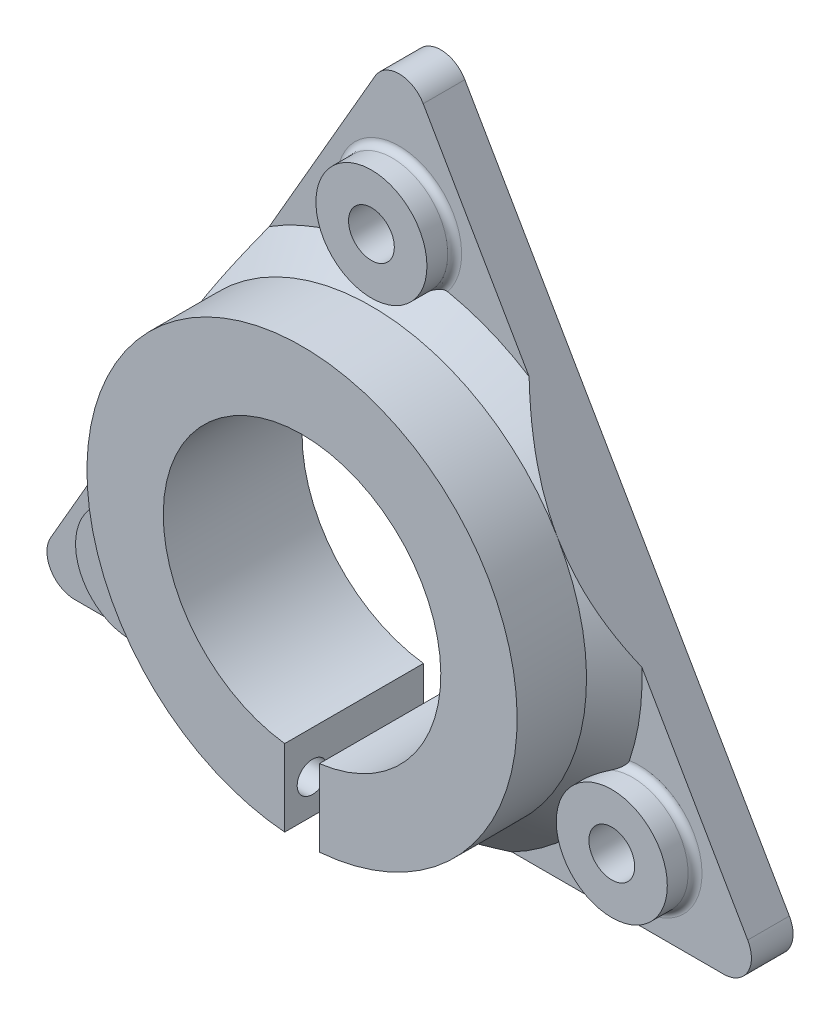
from build123d import *

# Parameters (mm, degrees)
SKETCH_1_R               = 1.65
SKETCH_1_R_2             = 9
EXTRUDE_1_DEPTH          = 3
SKETCH_2_R               = 15.5
SKETCH_2_R_2             = 9
EXTRUDE_2_DEPTH          = 7
SKETCH_3_W               = 2.5
SKETCH_3_H               = 20
CUT_EXTRUDE_1_DEPTH      = 28
CUT_EXTRUDE_2_DEPTH      = 44.016618519
CUT_EXTRUDE_2_DEPTH_BACK = 44.016618519
SKETCH_4_R               = 1.1
SKETCH_5_R               = 10
CUT_EXTRUDE_3_DEPTH      = 43.210780613
SKETCH_6_R               = 1.9
CUT_EXTRUDE_8_DEPTH      = 13
CHAMFER_1_SIZE           = 2
FILLET_2_R               = 2
SKETCH_7_R               = 4
SKETCH_7_R_2             = 1.65
EXTRUDE_3_DEPTH          = 2
FILLET_3_R               = 0.5


with BuildPart() as part:
    # 草图1 → 凸台-拉伸1 (new body)
    with BuildSketch(Plane.XY):
        Polygon((0, 31), (-26.846787517, -15.5), (26.846787517, -15.5), align=None)
        with Locations((0, 20)):
            Circle(SKETCH_1_R, mode=Mode.SUBTRACT)
        with Locations((17.320508076, -10)):
            Circle(SKETCH_1_R, mode=Mode.SUBTRACT)
        with Locations((-17.320508076, -10)):
            Circle(SKETCH_1_R, mode=Mode.SUBTRACT)
        Circle(SKETCH_1_R_2, mode=Mode.SUBTRACT)
    extrude(amount=EXTRUDE_1_DEPTH)

    # 草图2 → 凸台-拉伸2 (add)
    with BuildSketch(Plane.XY.offset(3)):
        with Locations(Location((0, 0, 0), (0, 0, 150))):
            Circle(SKETCH_2_R)
        Circle(SKETCH_2_R_2, mode=Mode.SUBTRACT)
    extrude(amount=EXTRUDE_2_DEPTH)

    # 草图3 → 切除-拉伸1 (cut)
    with BuildSketch(Plane.XY.offset(10)):
        with Locations((0, -9)):
            Rectangle(SKETCH_3_W, SKETCH_3_H)
    extrude(amount=-CUT_EXTRUDE_1_DEPTH, mode=Mode.SUBTRACT)

    # 草图4 → 切除-拉伸2 (cut, two sides: drawn at the far end of the back side and taken through both)
    with BuildSketch(Plane(origin=(-1.25, 0, 0), x_dir=(0, 0, -1), z_dir=(1, 0, 0)).offset(-CUT_EXTRUDE_2_DEPTH_BACK)):
        with Locations(Location((-8, -13, 0), (0, 0, 90))):
            Circle(SKETCH_4_R)
    extrude(amount=CUT_EXTRUDE_2_DEPTH + CUT_EXTRUDE_2_DEPTH_BACK, mode=Mode.SUBTRACT)

    # 草图5 → 切除-拉伸3 (cut, through all)
    with BuildSketch(Plane.XY.offset(10)):
        Circle(SKETCH_5_R)
    extrude(amount=-CUT_EXTRUDE_3_DEPTH, mode=Mode.SUBTRACT)

    # 草图6 → 切除-拉伸8 (cut)
    with BuildSketch(Plane(origin=(18.75, 0, 0), x_dir=(0, 0, -1), z_dir=(1, 0, 0))):
        with Locations((-8, -13)):
            Circle(SKETCH_6_R)
    cut_extrude_8 = extrude(amount=-CUT_EXTRUDE_8_DEPTH, mode=Mode.SUBTRACT)

    # 镜向1: 切除-拉伸8 across plane
    add(cut_extrude_8.mirror(Plane(origin=(0, 0, 0), x_dir=(0, 0, 1), z_dir=(1, 0, 0))), mode=Mode.SUBTRACT)

    # 倒角1
    # the kernel refuses this chamfer: 2 mm, written as the material it adds along each edge
    with BuildSketch(Plane(origin=(0, 0, 3), x_dir=(-0.24867915141291427, -0.9685859175378057, 0), z_dir=(-0.9685859175378057, 0.24867915141291427, 0))) as chamfer_1_piece_1_section:
        Polygon((15.5 + CHAMFER_1_SIZE, 0), (15.5, CHAMFER_1_SIZE), (15.5, 0), align=None)
    chamfer_1_piece_1 = revolve(axis=Axis((0, 0, 3), (0, 0, 1)), revolution_arc=134.399365049, mode=Mode.PRIVATE)
    chamfer_1_piece_1 = split(chamfer_1_piece_1, bisect_by=Plane(origin=(-1.25, -15.346279834, 3.925823909), z_dir=(-1, 0, 0)), keep=Keep.TOP, mode=Mode.PRIVATE)
    chamfer_1_piece_1 = split(chamfer_1_piece_1, bisect_by=Plane(origin=(-2.983750464, -15.5, 3.925823909), z_dir=(0, 1, 0)), keep=Keep.TOP, mode=Mode.PRIVATE)
    add(chamfer_1_piece_1)
    with BuildSketch(Plane(origin=(0, 0, 3), x_dir=(-0.24867915141291427, -0.9685859175378057, 0), z_dir=(-0.9685859175378057, 0.24867915141291427, 0))) as chamfer_1_piece_2_section:
        Polygon((15.5 + CHAMFER_1_SIZE, 0), (15.5, CHAMFER_1_SIZE), (15.5, 0), align=None)
    chamfer_1_piece_2 = revolve(axis=Axis((0, 0, 3), (0, 0, 1)), revolution_arc=134.399365049, mode=Mode.PRIVATE)
    chamfer_1_piece_2 = split(chamfer_1_piece_2, bisect_by=Plane(origin=(1.25, -7.656401186, 3.97388988), z_dir=(1, 0, 0)), keep=Keep.TOP, mode=Mode.PRIVATE)
    chamfer_1_piece_2 = split(chamfer_1_piece_2, bisect_by=Plane(origin=(14.586588654, -15.5, 3.97388988), z_dir=(0, 1, 0)), keep=Keep.TOP, mode=Mode.PRIVATE)
    chamfer_1_piece_2 = split(chamfer_1_piece_2, bisect_by=Plane(origin=(20.385359887, -4.308479054, 3.97388988), z_dir=(-0.8660254037844387, -0.5000000000000001, 0)), keep=Keep.TOP, mode=Mode.PRIVATE)
    add(chamfer_1_piece_2)
    with BuildSketch(Plane(origin=(0, 0, 3), x_dir=(-0.8660254037844386, 0.4999999999999999, 0), z_dir=(0.4999999999999999, 0.8660254037844386, 0))) as chamfer_1_piece_3_section:
        Polygon((15.5 + CHAMFER_1_SIZE, 0), (15.5, CHAMFER_1_SIZE), (15.5, 0), align=None)
    chamfer_1_piece_3 = revolve(axis=Axis((0, 0, 3), (0, 0, 1)), revolution_arc=134.399364936, mode=Mode.PRIVATE)
    chamfer_1_piece_3 = split(chamfer_1_piece_3, bisect_by=Plane(origin=(-20.385359891, -4.308479063, 3.973889878), z_dir=(0.8660254037844387, -0.5000000000000001, 0)), keep=Keep.TOP, mode=Mode.PRIVATE)
    chamfer_1_piece_3 = split(chamfer_1_piece_3, bisect_by=Plane(origin=(-1.25, -7.656401201, 3.973889878), z_dir=(-1, 0, 0)), keep=Keep.TOP, mode=Mode.PRIVATE)
    chamfer_1_piece_3 = split(chamfer_1_piece_3, bisect_by=Plane(origin=(-14.586588647, -15.5, 3.973889878), z_dir=(0, 1, 0)), keep=Keep.TOP, mode=Mode.PRIVATE)
    add(chamfer_1_piece_3)
    with BuildSketch(Plane(origin=(0, 0, 3), x_dir=(-0.8660254037844386, 0.4999999999999999, 0), z_dir=(0.4999999999999999, 0.8660254037844386, 0))) as chamfer_1_piece_4_section:
        Polygon((15.5 + CHAMFER_1_SIZE, 0), (15.5, CHAMFER_1_SIZE), (15.5, 0), align=None)
    chamfer_1_piece_4 = revolve(axis=Axis((0, 0, 3), (0, 0, 1)), revolution_arc=134.399364936, mode=Mode.PRIVATE)
    chamfer_1_piece_4 = split(chamfer_1_piece_4, bisect_by=Plane(origin=(1.25, -15.346279834, 3.925823908), z_dir=(1, 0, 0)), keep=Keep.TOP, mode=Mode.PRIVATE)
    chamfer_1_piece_4 = split(chamfer_1_piece_4, bisect_by=Plane(origin=(2.983750464, -15.5, 3.925823908), z_dir=(0, 1, 0)), keep=Keep.TOP, mode=Mode.PRIVATE)
    add(chamfer_1_piece_4)
    with BuildSketch(Plane(origin=(0, 0, 3), x_dir=(0.8660254027930385, 0.5000000017171554, 0), z_dir=(0.5000000017171554, -0.8660254027930385, 0))) as chamfer_1_piece_5_section:
        Polygon((15.5, CHAMFER_1_SIZE), (15.5 + CHAMFER_1_SIZE, 0), (15.5, 0), align=None)
    chamfer_1_piece_5 = revolve(axis=Axis((0, 0, 3), (0, 0, 1)), revolution_arc=119.999999886, mode=Mode.PRIVATE)
    chamfer_1_piece_5 = split(chamfer_1_piece_5, bisect_by=Plane(origin=(-6.289993318, 20.105411993, 3.973882667), z_dir=(0.8660254037844387, -0.5000000000000001, 0)), keep=Keep.TOP, mode=Mode.PRIVATE)
    chamfer_1_piece_5 = split(chamfer_1_piece_5, bisect_by=Plane(origin=(6.28999331, 20.105412007, 3.973882667), z_dir=(-0.8660254037844387, -0.5000000000000001, 0)), keep=Keep.TOP, mode=Mode.PRIVATE)
    add(chamfer_1_piece_5)

    # 圆角2
    fillet_2_edges = [part.edges().sort_by_distance(p)[0] for p in [
        (26.846787517, -15.5, 1.5),
        (-26.846787517, -15.5, 1.5),
        (0, 31, 1.5),
    ]]
    fillet(fillet_2_edges, radius=FILLET_2_R)

    # 草图7 → 凸台-拉伸3 (add)
    # profile 1 of 3: a face of its own
    with BuildSketch(Plane.XY.offset(3)):
        with Locations(Location((0, 20, 0), (0, 0, 223.309380883))):
            Circle(SKETCH_7_R)
        with Locations((0, 20)):
            Circle(SKETCH_7_R_2, mode=Mode.SUBTRACT)
    # profile 2 of 3: a face of its own
    with BuildSketch(Plane.XY.offset(3)):
        with Locations(Location((17.320508076, -10, 0), (0, 0, 196.690618915))):
            Circle(SKETCH_7_R)
        with Locations((17.320508076, -10)):
            Circle(SKETCH_7_R_2, mode=Mode.SUBTRACT)
    # profile 3 of 3: a face of its own
    with BuildSketch(Plane.XY.offset(3)):
        with Locations(Location((-17.320508076, -10, 0), (0, 0, 76.690618915))):
            Circle(SKETCH_7_R)
        with Locations((-17.320508076, -10)):
            Circle(SKETCH_7_R_2, mode=Mode.SUBTRACT)
    extrude(amount=EXTRUDE_3_DEPTH)

    # 圆角3
    # the kernel refuses this fillet: 0.5 mm, written as the material it adds along each edge
    with BuildSketch(Plane(origin=(-17.320508076, -10, 3), x_dir=(0.5191846053523372, 0.854662123628477, 0), z_dir=(0.854662123628477, -0.5191846053523372, 0))) as fillet_3_piece_1:
        with BuildLine():
            CenterArc((4 + FILLET_3_R, FILLET_3_R), FILLET_3_R, 180, 90)
            Line((4 + FILLET_3_R, 0), (4, 0))
            Line((4, 0), (4, FILLET_3_R))
        make_face()
    revolve(axis=Axis((-17.320508076, -10, 3), (0, 0, 1)), revolution_arc=302.555144431)
    with BuildSketch(Plane(origin=(17.320508076, -10, 3), x_dir=(-0.9997514133907861, 0.022295995674683326, 0), z_dir=(0.022295995674683326, 0.9997514133907861, 0))) as fillet_3_piece_2:
        with BuildLine():
            CenterArc((4 + FILLET_3_R, FILLET_3_R), FILLET_3_R, 180, 90)
            Line((4, FILLET_3_R), (4, 0))
            Line((4, 0), (4 + FILLET_3_R, 0))
        make_face()
    revolve(axis=Axis((17.320508076, -10, 3), (0, 0, 1)), revolution_arc=302.555144431)
    with BuildSketch(Plane(origin=(0, 20, 3), x_dir=(0.4805668111313066, -0.8769581176082967, 0), z_dir=(-0.8769581176082967, -0.4805668111313066, 0))) as fillet_3_piece_3:
        with BuildLine():
            CenterArc((4 + FILLET_3_R, FILLET_3_R), FILLET_3_R, 180, 90)
            Line((4 + FILLET_3_R, 0), (4, 0))
            Line((4, 0), (4, FILLET_3_R))
        make_face()
    revolve(axis=Axis((0, 20, 3), (0, 0, 1)), revolution_arc=302.555144229)


solid = part.part
